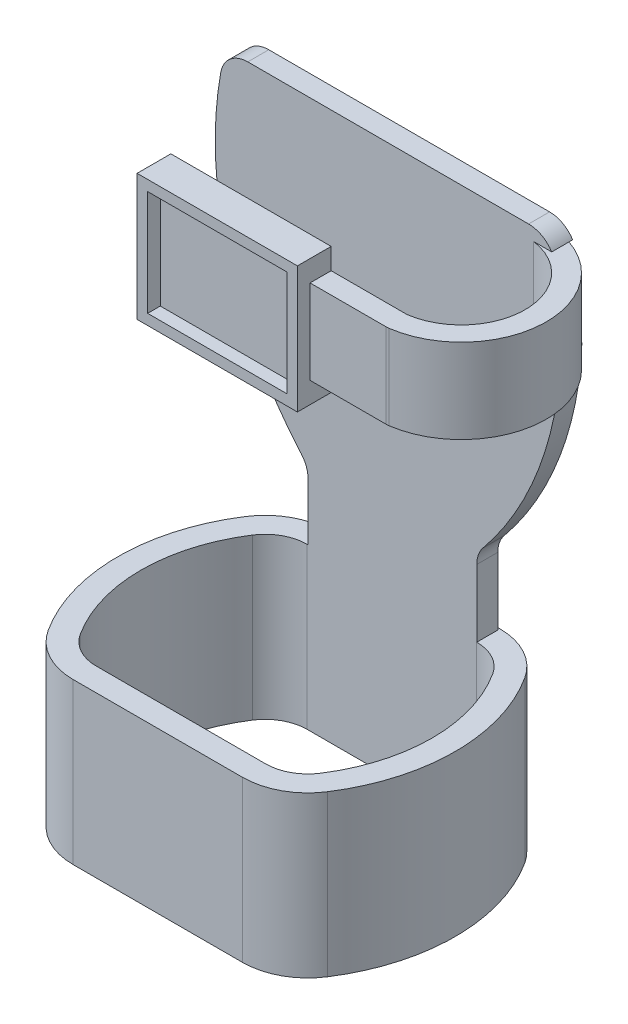
from build123d import *

# Parameters (mm, degrees)
CROQUIS1_W               = 2.2
CROQUIS1_H               = 25.999999999999993
CROQUIS1_W_2             = 2.200000000000003
CROQUIS1_H_2             = 26
SALIENTE_EXTRUIR2_DEPTH  = 3
SALIENTE_EXTRUIR3_DEPTH  = 20
CROQUIS3_R               = 7.999999999999991
CROQUIS3_R_2             = 8.000000000000002
CORTAR_EXTRUIR1_DEPTH    = 20
SALIENTE_EXTRUIR5_DEPTH  = 53.964297
CORTAR_EXTRUIR2_START    = -60
CROQUIS6_W               = 40.15324264759986
CROQUIS6_H               = 15.964297095512393
CORTAR_EXTRUIR2_DEPTH    = 60
CROQUIS7_W               = 5
CROQUIS7_H               = 20
SALIENTE_EXTRUIR7_DEPTH  = 33
SALIENTE_EXTRUIR8_START  = -5
CROQUIS9_W               = 30
CROQUIS9_H               = 30
SALIENTE_EXTRUIR8_DEPTH  = 5
SALIENTE_EXTRUIR9_START  = -20
SALIENTE_EXTRUIR9_DEPTH  = 20
SALIENTE_EXTRUIR10_START = -3
CROQUIS11_W              = 73.35697538547257
CROQUIS11_H              = 26
CROQUIS11_W_2            = 36
CROQUIS11_H_2            = 25.999999999999993
SALIENTE_EXTRUIR10_DEPTH = 3
CROQUIS12_R              = 15
CROQUIS12_R_2            = 12.499999999999995
SALIENTE_EXTRUIR13_DEPTH = 10
REDONDEO1_R              = 2
CORTAR_EXTRUIR4_DEPTH    = 134.84384260338862
SALIENTE_EXTRUIR15_DEPTH = 38
CROQUIS17_W              = 46
CROQUIS17_H              = 3
CORTAR_EXTRUIR5_DEPTH    = 20
CROQUIS18_W              = 58.34795028380313
CROQUIS18_H              = 55.73720719090147
CORTAR_EXTRUIR6_DEPTH    = 10
SALIENTE_EXTRUIR16_START = -5
SALIENTE_EXTRUIR16_DEPTH = 5
CROQUIS21_W              = 38.00000000000001
CROQUIS21_H              = 29.99999999999997
CROQUIS21_W_2            = 33.00000000000001
CROQUIS21_H_2            = 24.999999999999957
SALIENTE_EXTRUIR17_DEPTH = 3
SALIENTE_EXTRUIR18_DEPTH = 38
SALIENTE_EXTRUIR19_DEPTH = 1.974619


with BuildPart() as part:
    # Croquis1 → Saliente-Extruir2 (new body)
    with BuildSketch(Plane.XY):
        with BuildLine():
            ThreePointArc((1.78e-15, 6.500000000000045), (1.9038059222874422, 1.9038059222874395), (6.500000000000047, 0))
            Line((6.500000000000047, 0), (33.49999999999996, 0))
            ThreePointArc((33.49999999999996, 8.9e-16), (38.09619407771257, 1.9038059222874377), (40.00000000000001, 6.500000000000045))
            Line((40.00000000000001, 6.500000000000045), (39.99999999999999, 53.9642970955124))
            ThreePointArc((39.99999999999999, 53.9642970955124), (40.37823647136178, 56.149248193234044), (41.468926553672304, 58.07991369301713))
            ThreePointArc((41.468926553672304, 58.079913693017126), (57.39093897053555, 89.4797950941834), (58.67848769273629, 124.66225165562912))
            ThreePointArc((58.678487692736276, 124.66225165562913), (56.44829659298618, 128.49022222759615), (52.28324171709256, 130))
            Line((52.28324171709256, 130), (40.00000000000001, 130))
            Line((40.00000000000001, 130), (0, 130))
            Line((0, 130), (-14.283241717092526, 130))
            ThreePointArc((-14.283241717092526, 130), (-18.44829659298616, 128.49022222759615), (-20.678487692736265, 124.66225165562913))
            ThreePointArc((-20.67848769273626, 124.66225165562913), (-19.02022266397784, 88.0955618621395), (-1.615819209039536, 55.89370809971405))
            ThreePointArc((-1.6158192090395262, 55.89370809971404), (-0.41735357178952714, 53.89639076148384), (1.332e-14, 51.6047947173743))
            Line((1.324e-14, 51.6047947173743), (1.67e-15, 6.500000000000047))
        make_face()
        with Locations((3.1, 21.999999999999996)):
            Rectangle(CROQUIS1_W, CROQUIS1_H, mode=Mode.SUBTRACT)
        with Locations((36.9, 21.999999999999996)):
            Rectangle(CROQUIS1_W_2, CROQUIS1_H, mode=Mode.SUBTRACT)
        Polygon((-17.67848769273627, 127), (-15.478487692736273, 127), (-15.47848769273627, 101), (-17.678487692736265, 101), align=None, mode=Mode.SUBTRACT)
        with Locations((54.5784876927363, 114.00000000000001)):
            Rectangle(CROQUIS1_W_2, CROQUIS1_H_2, mode=Mode.SUBTRACT)
    extrude(amount=SALIENTE_EXTRUIR2_DEPTH)

    # Croquis2 → Saliente-Extruir3 (add)
    with BuildSketch(Plane(origin=(0, 0, 0), x_dir=(-1, 0, 0), z_dir=(0, 0, -1))):
        Polygon((4.481512307263694, 116.39887057980759), (4.481512307263693, 113.39887057980759), (-41.51848769273631, 113.39887057980758), (-41.51848769273631, 116.39887057980758), align=None)
    extrude(amount=SALIENTE_EXTRUIR3_DEPTH)

    # Croquis3 → Cortar-Extruir1 (cut)
    with BuildSketch(Plane(origin=(3.512e-14, 116.39887057980759, 0), x_dir=(1, -3e-16, 0), z_dir=(3e-16, 1, 0))):
        with Locations(Location((31.51848769273627, 9.999999999999998, 0), (0, 0, 180))):
            Circle(CROQUIS3_R)
        with Locations(Location((5.5184876927362705, 9.999999999999993, 0), (0, 0, 180))):
            Circle(CROQUIS3_R_2)
        Polygon((24.01848769273627, 20.000000000000004), (18.518487692736272, 20.000000000000004), (18.518487692736272, 15.000000000000005), (24.018487692736272, 15.000000000000004), align=None)
        Polygon((18.518487692736272, 15.000000000000005), (18.518487692736272, 20), (13.018487692736274, 20.000000000000004), (13.018487692736274, 15.000000000000005), align=None)
    extrude(amount=-CORTAR_EXTRUIR1_DEPTH, mode=Mode.SUBTRACT)

    # Croquis5 → Saliente-Extruir5 (add)
    with BuildSketch(Plane.XZ):
        with BuildLine():
            Line((39.96433456524687, 63.000000000000014), (-0.18890808235298706, 63.000000000000014))
            ThreePointArc((-0.18890808235298706, 63.000000000000014), (-7.362306106958867, 61.1735477674232), (-12.788788286604273, 56.138981437410735))
            ThreePointArc((-12.788788286604273, 56.138981437410735), (-19.612286758553036, 32.99999999999998), (-12.788788286604271, 9.861018562589255))
            ThreePointArc((-12.788788286604271, 9.861018562589255), (-7.362306106958855, 4.826452232576806), (-0.18890808235298392, 2.9999999999999956))
            Line((-0.18890808235298392, 2.9999999999999956), (39.96433456524688, 3))
            ThreePointArc((39.96433456524688, 3), (47.137732589852746, 4.826452232576804), (52.56421476949815, 9.861018562589242))
            ThreePointArc((52.56421476949815, 9.861018562589242), (59.38771324144694, 33.00000000000001), (52.56421476949814, 56.13898143741078))
            ThreePointArc((52.56421476949814, 56.13898143741078), (47.13773258985273, 61.17354776742321), (39.96433456524687, 63.000000000000014))
        make_face()
        with BuildLine():
            Line((39.96433456524688, 8), (-0.18890808235298012, 7.999999999999995))
            ThreePointArc((-0.18890808235298012, 7.999999999999995), (-4.971173432090228, 9.217634821717866), (-8.5888282185205, 12.5740123750595))
            ThreePointArc((-8.5888282185205, 12.5740123750595), (-14.612286758553036, 32.99999999999998), (-8.588828218520513, 53.4259876249405))
            ThreePointArc((-8.588828218520513, 53.4259876249405), (-4.971173432090235, 56.78236517828213), (-0.18890808235298706, 58))
            Line((-0.18890808235298706, 58), (39.96433456524687, 58.00000000000001))
            ThreePointArc((39.96433456524687, 58.00000000000001), (44.74659991498412, 56.78236517828215), (48.364254701414396, 53.425987624940525))
            ThreePointArc((48.364254701414396, 53.425987624940525), (54.387713241446946, 33.00000000000001), (48.364254701414396, 12.5740123750595))
            ThreePointArc((48.364254701414396, 12.5740123750595), (44.746599914984124, 9.21763482171787), (39.96433456524688, 8))
        make_face(mode=Mode.SUBTRACT)
    extrude(amount=-SALIENTE_EXTRUIR5_DEPTH)

    # Croquis6 → Cortar-Extruir2 (cut)
    with BuildSketch(Plane.XY.offset(63.000000000000014).offset(CORTAR_EXTRUIR2_START)):
        Polygon((-65.140227080974, 38), (-0.18890808235298706, 38), (-0.18890808235298706, 53.9642970955124), (39.96433456524687, 53.9642970955124), (39.96433456524687, 38), (86.01153637442849, 38), (86.01153637442849, 58.052685675367144), (-65.140227080974, 58.052685675367144), align=None)
        with Locations((19.887713241446942, 45.982148547756196)):
            Rectangle(CROQUIS6_W, CROQUIS6_H)
    extrude(amount=CORTAR_EXTRUIR2_DEPTH, mode=Mode.SUBTRACT)



with BuildPart() as body_2:
    # Croquis7 → Saliente-Extruir7 (new body)
    with BuildSketch(Plane(origin=(53.4784876927363, 0, 0), x_dir=(0, 0, -1), z_dir=(1, 0, 0))):
        with Locations((-35.5, 117.00000000000001)):
            Rectangle(CROQUIS7_W, CROQUIS7_H)
    extrude(amount=-SALIENTE_EXTRUIR7_DEPTH)

    # Croquis9 → Saliente-Extruir8 (add)
    with BuildSketch(Plane.XY.offset(38).offset(SALIENTE_EXTRUIR8_START)):
        with Locations((20.478487692736316, 117.00000000000003)):
            Rectangle(CROQUIS9_W, CROQUIS9_H)
    extrude(amount=SALIENTE_EXTRUIR8_DEPTH)


with BuildPart() as part_1:
    add(part.part)

    add(body_2.part)  # Saliente-Extruir9 merges body 2
    # Croquis10 → Saliente-Extruir9 (add)
    with BuildSketch(Plane(origin=(0, 127, 0), x_dir=(1, 0, 0), z_dir=(0, 1, 0)).offset(SALIENTE_EXTRUIR9_START)):
        with BuildLine():
            Line((54.189147591213455, -37.94923857868021), (53.4784876927363, -38))
            Line((53.4784876927363, -38), (53.4784876927363, -33))
            ThreePointArc((53.4784876927363, -33), (66.4784876927363, -18.000000000000004), (53.4784876927363, -2.9999999999999996))
            Line((53.4784876927363, -2.9999999999999996), (53.4784876927363, 0))
            Line((53.4784876927363, 0), (51.4784876927363, -4.3e-16))
            Line((51.4784876927363, -4.3e-16), (51.4784876927363, 1.9999999999999996))
            Line((51.4784876927363, 1.9999999999999996), (53.4784876927363, 2))
            Line((53.4784876927363, 2), (54.18914759121346, 1.9492385786802033))
            ThreePointArc((54.18914759121346, 1.9492385786802033), (71.47848769273631, -18.000000000000007), (54.189147591213455, -37.94923857868021))
        make_face()
    extrude(amount=SALIENTE_EXTRUIR9_DEPTH)

    # Croquis11 → Saliente-Extruir10 (add)
    with BuildSketch(Plane(origin=(0, 0, 0), x_dir=(-1, 0, 0), z_dir=(0, 0, -1)).offset(SALIENTE_EXTRUIR10_START)):
        with Locations((-19.000000000000018, 114.00000000000001)):
            Rectangle(CROQUIS11_W, CROQUIS11_H)
        with Locations((-20, 21.999999999999996)):
            Rectangle(CROQUIS11_W_2, CROQUIS11_H_2)
    extrude(amount=SALIENTE_EXTRUIR10_DEPTH)

    # Croquis12 → Saliente-Extruir13 (add)
    with BuildSketch(Plane.XY.offset(38)):
        with Locations(Location((20.478487692736316, 117.00000000000003, 0), (0, 0, 180))):
            Circle(CROQUIS12_R)
        with Locations((20.478487692736316, 117.00000000000003)):
            Circle(CROQUIS12_R_2, mode=Mode.SUBTRACT)
    extrude(amount=SALIENTE_EXTRUIR13_DEPTH)

    # Redondeo1
    redondeo1_edges = [part_1.edges().sort_by_distance(p)[0] for p in [
        (51.4784876927363, 117, -1.9999999999999996),
    ]]
    fillet(redondeo1_edges, radius=REDONDEO1_R - 0.0001)  # a hair under: the kernel refuses the full size

    # Croquis14 → Cortar-Extruir4 (cut, through all)
    with BuildSketch(Plane(origin=(0, 38, 0), x_dir=(1, 0, 0), z_dir=(0, 1, 0))):
        with BuildLine():
            ThreePointArc((48.36425493229366, -7.57401013919257), (44.74660042130513, -4.217634185252958), (39.96433624040055, -2.9999999999999822))
            Line((39.96433624040055, -2.999999999999983), (7.11e-15, -2.999999999999993))
            Line((7.11e-15, -2.999999999999993), (-0.18890808235298095, -2.999999999999993))
            ThreePointArc((-0.1889080823529836, -2.999999999999993), (-4.9711734320902385, -4.217634821717869), (-8.58882821852051, -7.5740123750595165))
            ThreePointArc((-8.588828218520508, -7.574012375059517), (-14.612286758553015, -27.99999999999999), (-8.588828218520522, -48.42598762494047))
            ThreePointArc((-8.588828218520526, -48.425987624940475), (-4.971173432090255, -51.78236517828213), (-0.18890808235300008, -53.00000000000001))
            Line((-0.18890808235300227, -53.00000000000001), (39.964336240400556, -53.00000000000002))
            ThreePointArc((39.964336240400556, -53.00000000000002), (44.74660042130514, -51.78236581474704), (48.36425493229367, -48.42598986080743))
            ThreePointArc((48.36425493229366, -48.42598986080742), (54.38771708653283, -27.999999999999993), (48.36425493229366, -7.574010139192573))
        make_face()
        with BuildLine():
            ThreePointArc((52.56421476949813, -56.13898143741079), (59.326001019675516, -35.29338058691803), (54.84218308379573, -13.842128762629663))
            ThreePointArc((54.84218308379583, -13.842128762629622), (57.147087828663246, -32.41618815306372), (50.88423053986159, -50.05378681904967))
            ThreePointArc((50.88423053986159, -50.05378681904967), (46.181279675576505, -54.41707555917115), (39.964336240400556, -56.00000000000002))
            Line((39.964336240400556, -56.00000000000002), (-0.18890808235300227, -56.00000000000002))
            ThreePointArc((-0.18890808235300094, -56.00000000000002), (-6.40585303701144, -54.417074731766775), (-11.108804259370787, -50.05378391242262))
            ThreePointArc((-11.108804259370793, -50.05378391242262), (-17.37165915295804, -32.41617365692677), (-15.066744784377477, -13.84210526315766))
            ThreePointArc((-15.066744784377445, -13.84210526315767), (-19.550575244054688, -35.29336745437739), (-12.788788286604277, -56.138981437410735))
            ThreePointArc((-12.788788286604277, -56.138981437410735), (-7.362306106958864, -61.17354776742319), (-0.18890808235299072, -63))
            Line((-0.18890808235298845, -63), (39.96433456524687, -63.000000000000014))
            ThreePointArc((39.96433456524687, -63.000000000000014), (47.137732589852725, -61.173547767423216), (52.56421476949813, -56.13898143741079))
        make_face()
    extrude(amount=-CORTAR_EXTRUIR4_DEPTH, mode=Mode.SUBTRACT)


with BuildPart() as cortar_extruir4_piece_1:
    # of the separate pieces the step leaves, piece 1, a body of its own (cortar_extruir4_pieces)
    add(part_1.part.solids().sort_by_distance((51.478487693, 127, -0.0001))[0])



with BuildPart() as cortar_extruir4_piece_2:
    # of the separate pieces the step leaves, piece 2, a body of its own (cortar_extruir4_pieces)
    add(part_1.part.solids().sort_by_distance((39.964334565, 0, 3))[0])


with BuildPart() as cortar_extruir4_piece_3:
    # of the separate pieces the step leaves, piece 3, a body of its own (cortar_extruir4_pieces)
    add(part_1.part.solids().sort_by_distance((-0.188908082, 38, 3))[0])


with BuildPart() as cortar_extruir4_piece_1_1:
    add(cortar_extruir4_piece_1.part)

    add(cortar_extruir4_piece_2.part)  # Saliente-Extruir15 merges Cortar-Extruir4 piece 2

    add(cortar_extruir4_piece_3.part)  # Saliente-Extruir15 merges Cortar-Extruir4 piece 3
    # Croquis16 → Saliente-Extruir15 (add)
    with BuildSketch(Plane(origin=(0, 38, 0), x_dir=(1, 0, 0), z_dir=(0, 1, 0))):
        with BuildLine():
            Line((39.96433624040056, 6.07e-15), (-0.18890808235298012, 6.07e-15))
            ThreePointArc((-0.18890808235298012, 6.07e-15), (-6.405853037011415, -1.5829252682332342), (-11.108804259370778, -5.946216087577372))
            ThreePointArc((-11.108804259370778, -5.946216087577372), (-17.61228675855303, -27.999999999999996), (-11.108804259370793, -50.05378391242263))
            ThreePointArc((-11.108804259370793, -50.05378391242263), (-6.405853037011435, -54.417074731766775), (-0.1889080823529964, -56.000000000000014))
            Line((-0.1889080823529964, -56.000000000000014), (39.96433624040056, -56.00000000000002))
            ThreePointArc((39.96433624040056, -56.00000000000002), (46.18127967557652, -54.417075559171145), (50.884230539861605, -50.053786819049655))
            ThreePointArc((50.884230539861605, -50.053786819049655), (57.387717086532845, -28.00000000000002), (50.88423053986163, -5.946213180950382))
            ThreePointArc((50.88423053986163, -5.946213180950382), (46.18127967557653, -1.5829244408288794), (39.96433624040056, 6.07e-15))
        make_face()
        with BuildLine():
            Line((39.96433624040056, -2.999999999999994), (-0.18890808235298012, -2.999999999999994))
            ThreePointArc((-0.18890808235298012, -2.999999999999994), (-4.971173432090238, -4.217634821717871), (-8.588828218520524, -7.574012375059513))
            ThreePointArc((-8.588828218520524, -7.574012375059513), (-14.61228675855303, -27.999999999999996), (-8.588828218520524, -48.42598762494049))
            ThreePointArc((-8.588828218520524, -48.42598762494049), (-4.97117343209025, -51.782365178282134), (-0.188908082352994, -53.00000000000002))
            Line((-0.188908082352994, -53.00000000000002), (39.96433624040056, -53.00000000000002))
            ThreePointArc((39.96433624040056, -53.00000000000002), (44.746600421305146, -51.78236581474704), (48.364254932293676, -48.42598986080743))
            ThreePointArc((48.364254932293676, -48.42598986080743), (54.387717086532845, -28.000000000000004), (48.364254932293676, -7.574010139192587))
            ThreePointArc((48.364254932293676, -7.574010139192587), (44.746600421305146, -4.217634185252978), (39.96433624040056, -2.999999999999994))
        make_face(mode=Mode.SUBTRACT)
    extrude(amount=-SALIENTE_EXTRUIR15_DEPTH)

    # Croquis17 → Cortar-Extruir5 (cut)
    with BuildSketch(Plane(origin=(0, 0, -20), x_dir=(-1, 0, 0), z_dir=(0, 0, -1))):
        with Locations((-18.518487692736308, 114.89887057980759)):
            Rectangle(CROQUIS17_W, CROQUIS17_H)
    extrude(amount=-CORTAR_EXTRUIR5_DEPTH, mode=Mode.SUBTRACT)

    # Croquis18 → Cortar-Extruir6 (cut)
    with BuildSketch(Plane.XY.offset(48)):
        with Locations((19.45719587983774, 118.79603010754636)):
            Rectangle(CROQUIS18_W, CROQUIS18_H)
    extrude(amount=-CORTAR_EXTRUIR6_DEPTH, mode=Mode.SUBTRACT)

    # Croquis20 → Saliente-Extruir16 (add)
    with BuildSketch(Plane.XY.offset(38).offset(SALIENTE_EXTRUIR16_START)):
        Polygon((5.478487692736317, 104.49999999999999), (5.478487692736317, 129.5), (-0.02151230726369135, 129.5), (-0.02151230726368802, 104.49999999999999), align=None)
        Polygon((-0.02151230726369135, 129.5), (5.478487692736316, 129.5), (5.478487692736317, 132.00000000000003), (-2.5215123072636914, 132), (-2.5215123072636847, 101.99999999999999), (5.478487692736316, 101.99999999999999), (5.478487692736317, 104.49999999999999), (-0.02151230726369135, 104.49999999999999), align=None)
    extrude(amount=SALIENTE_EXTRUIR16_DEPTH)

    # Croquis21 → Saliente-Extruir17 (add)
    with BuildSketch(Plane.XY.offset(38)):
        with Locations((16.478487692736312, 117.00000000000001)):
            Rectangle(CROQUIS21_W, CROQUIS21_H)
        with Locations((16.478487692736312, 117.00000000000003)):
            Rectangle(CROQUIS21_W_2, CROQUIS21_H_2, mode=Mode.SUBTRACT)
    extrude(amount=SALIENTE_EXTRUIR17_DEPTH)

    # Croquis22 → Saliente-Extruir18 (add)
    with BuildSketch(Plane.XZ):
        with BuildLine():
            Line((-0.18890808235298298, -2.5000000000000075), (39.96433624040056, -2.500000000000006))
            ThreePointArc((39.96433624040056, -2.500000000000006), (47.376845720802685, -0.6126670128578695), (52.98421021283491, 4.589715715748548))
            ThreePointArc((52.98421021283491, 4.589715715748548), (59.88771708653283, 28.000000000000032), (52.98421021283489, 51.41028428425151))
            ThreePointArc((52.98421021283489, 51.41028428425151), (47.37684572080267, 56.612667012857905), (39.96433624040056, 58.50000000000002))
            Line((39.96433624040056, 58.50000000000002), (-0.18890808235299306, 58.50000000000001))
            ThreePointArc((-0.18890808235299306, 58.50000000000001), (-7.601419374445746, 56.612666026337294), (-13.20878429341268, 51.41028081865773))
            ThreePointArc((-13.20878429341268, 51.41028081865773), (-20.11228675855303, 27.999999999999986), (-13.208784293412673, 4.589719181342242))
            ThreePointArc((-13.208784293412673, 4.589719181342242), (-7.601419374445738, -0.6126660263373136), (-0.18890808235298298, -2.5000000000000075))
        make_face()
        with BuildLine():
            Line((-0.1889080823529825, -6.94e-15), (39.96433624040056, -6.07e-15))
            ThreePointArc((39.96433624040056, -6.07e-15), (46.18127967557653, 1.582924440828883), (50.88423053986163, 5.946213180950394))
            ThreePointArc((50.88423053986163, 5.946213180950394), (57.387717086532845, 28.000000000000032), (50.884230539861605, 50.05378681904966))
            ThreePointArc((50.884230539861605, 50.05378681904966), (46.18127967557652, 54.41707555917115), (39.96433624040056, 56.00000000000002))
            Line((39.96433624040056, 56.00000000000002), (-0.18890808235299322, 56.000000000000014))
            ThreePointArc((-0.18890808235299322, 56.000000000000014), (-6.405853037011434, 54.417074731766775), (-11.108804259370794, 50.053783912422624))
            ThreePointArc((-11.108804259370794, 50.053783912422624), (-17.612286758553036, 27.999999999999986), (-11.108804259370785, 5.946216087577363))
            ThreePointArc((-11.108804259370785, 5.946216087577363), (-6.405853037011422, 1.5829252682332218), (-0.1889080823529825, -6.94e-15))
        make_face(mode=Mode.SUBTRACT)
    extrude(amount=-SALIENTE_EXTRUIR18_DEPTH)

    # Croquis23 → Saliente-Extruir19 (add)
    with BuildSketch(Plane(origin=(0, 0, 0), x_dir=(-1, 0, 0), z_dir=(0, 0, -1))):
        with BuildLine():
            Line((-39.99999999999999, 38), (-6.94e-15, 38))
            Line((-6.94e-15, 38), (-1.324e-14, 51.6047947173743))
            ThreePointArc((-1.324e-14, 51.6047947173743), (0.4173535717895369, 53.89639076148386), (1.615819209039554, 55.893708099714054))
            ThreePointArc((1.615819209039554, 55.893708099714054), (19.020222663977847, 88.09556186213952), (20.67848769273625, 124.66225165562916))
            ThreePointArc((20.67848769273625, 124.66225165562916), (18.448296592986146, 128.49022222759615), (14.283241717092526, 130))
            Line((14.283241717092526, 130), (-52.28324171709256, 130))
            ThreePointArc((-52.28324171709256, 130), (-55.40574071629176, 129.20087712549568), (-57.76046729214422, 127))
            Line((-57.76046729214422, 127), (-51.4784876927363, 127))
            Line((-51.4784876927363, 127), (-51.4784876927363, 107))
            Line((-51.4784876927363, 107), (-59.945103575503516, 107))
            ThreePointArc((-59.945103575503516, 107), (-54.711170964031545, 81.02766406850974), (-41.46892655367233, 58.07991369301716))
            ThreePointArc((-41.46892655367233, 58.07991369301716), (-40.37823647136178, 56.149248193234065), (-39.999999999999986, 53.9642970955124))
            Line((-39.999999999999986, 53.9642970955124), (-39.99999999999999, 38))
        make_face()
    extrude(amount=SALIENTE_EXTRUIR19_DEPTH)


solid = cortar_extruir4_piece_1_1.part
